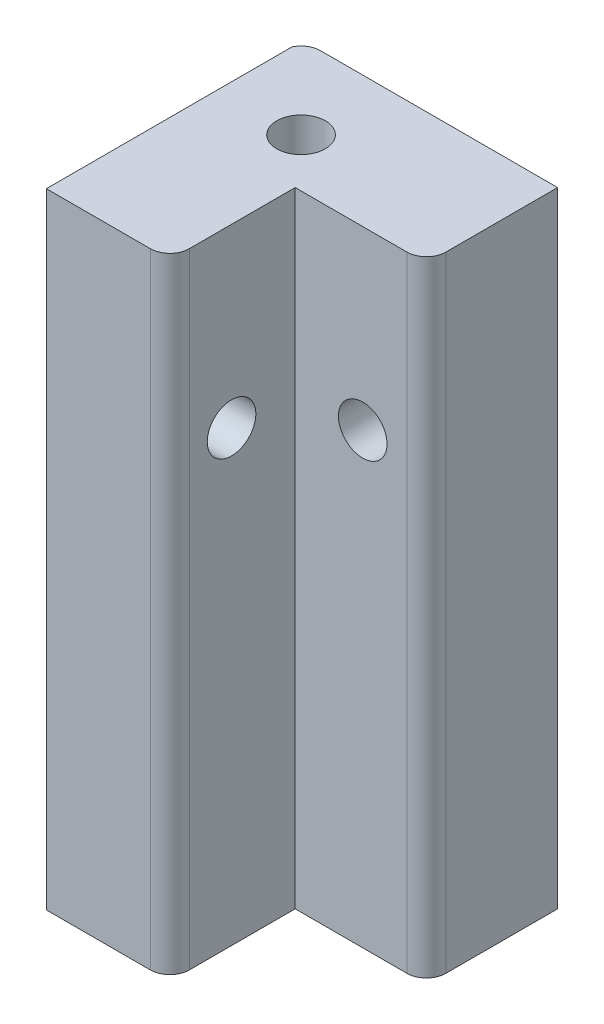
from build123d import *

# Parameters (mm, degrees)
HOLE_TOPMAIN_OUTLINE_W = 12.9
HOLE_TOPMAIN_OUTLINE_H = 12.9
HOLE_TOPMAIN_OUTLINE_R = 2.5
HOLE_TOPMAIN_DEPTH     = 64.27
SKETCH14_R             = 2.5
CUT_EXTRUDE9_DEPTH     = 67.100627077
SKETCH15_R             = 3.25
CUT_EXTRUDE10_DEPTH    = 66.309210028
SKETCH18_W             = 12.9
SKETCH18_H             = 64.27
SKETCH18_R             = 3.25
BOSS_EXTRUDE2_DEPTH    = 13.5
FILLET3_R              = 2
SKETCH19_R             = 2.5
CUT_EXTRUDE11_DEPTH    = 13.5
SKETCH22_W             = 13.5
SKETCH22_H             = 64.27
BOSS_EXTRUDE3_DEPTH    = 13.5
BOSS_EXTRUDE5_START    = -26.4
SKETCH24_R             = 3.25
BOSS_EXTRUDE5_DEPTH    = 26.4
CUT_EXTRUDE12_START    = -64.27
SKETCH25_R             = 2.5
CUT_EXTRUDE12_DEPTH    = 64.27
SKETCH26_R             = 2.5
CUT_EXTRUDE13_DEPTH    = 13.5
SKETCH28_R             = 2.5
CUT_EXTRUDE14_DEPTH    = 13.5
FILLET4_R              = 2
SKETCH29_W             = 0.2
SKETCH29_H             = 25.271779789
CUT_EXTRUDE15_DEPTH    = 64.27


# Read off the part's stored shape, not the designer's step: hole-TopMain
with BuildPart() as part:
    # hole-TopMain outline → hole-TopMain (new body)
    with BuildSketch(Plane(origin=(0, 0, 0), x_dir=(1, 0, 0), z_dir=(0, 1, 0))):
        with Locations((-2.05, 2.05)):
            Rectangle(HOLE_TOPMAIN_OUTLINE_W, HOLE_TOPMAIN_OUTLINE_H)
        Circle(HOLE_TOPMAIN_OUTLINE_R, mode=Mode.SUBTRACT)
    extrude(amount=HOLE_TOPMAIN_DEPTH)

    # Sketch14 → Cut-Extrude9 (cut, through all)
    with BuildSketch(Plane(origin=(0, 0, -8.5), x_dir=(-1, 0, 0), z_dir=(0, 0, -1))):
        with Locations((1.75, 46.135)):
            Circle(SKETCH14_R)
    extrude(amount=-CUT_EXTRUDE9_DEPTH, mode=Mode.SUBTRACT)

    # Sketch15 → Cut-Extrude10 (cut, through all)
    with BuildSketch(Plane(origin=(0, 0, -3.5), x_dir=(-1, 0, 0), z_dir=(0, 0, -1))):
        with Locations((1.75, 46.135)):
            Circle(SKETCH15_R)
    extrude(amount=-CUT_EXTRUDE10_DEPTH, mode=Mode.SUBTRACT)

    # Sketch18 → Boss-Extrude2 (add)
    with BuildSketch(Plane.XY.offset(4.4)):
        with Locations((-2.05, 32.135)):
            Rectangle(SKETCH18_W, SKETCH18_H)
        with Locations(Location((-1.75, 46.135, 0), (0, 0, 180))):
            Circle(SKETCH18_R, mode=Mode.SUBTRACT)
    extrude(amount=BOSS_EXTRUDE2_DEPTH)

    # Fillet3
    fillet3_edges = [part.edges().sort_by_distance(p)[0] for p in [
        (-8.5, 32.135, -8.5),
        (4.4, 32.135, 17.9),
    ]]
    fillet(fillet3_edges, radius=FILLET3_R)

    # Sketch19 → Cut-Extrude11 (cut)
    with BuildSketch(Plane.ZY.offset(8.5)):
        with Locations((11.55, 46.135)):
            Circle(SKETCH19_R)
    extrude(amount=-CUT_EXTRUDE11_DEPTH, mode=Mode.SUBTRACT)

    # Sketch22 → Boss-Extrude3 (add)
    with BuildSketch(Plane(origin=(4.4, 0, 0), x_dir=(0, 0, -1), z_dir=(1, 0, 0))):
        with Locations((1.75, 32.135)):
            Rectangle(SKETCH22_W, SKETCH22_H)
    extrude(amount=BOSS_EXTRUDE3_DEPTH)

    # Sketch24 → Boss-Extrude5 (add)
    with BuildSketch(Plane.XY.offset(17.9).offset(BOSS_EXTRUDE5_START)):
        with Locations((-1.75, 46.135)):
            Circle(SKETCH24_R)
    extrude(amount=BOSS_EXTRUDE5_DEPTH)

    # Sketch25 → Cut-Extrude12 (cut)
    with BuildSketch(Plane(origin=(0, 64.27, 0), x_dir=(1, 0, 0), z_dir=(0, 1, 0)).offset(CUT_EXTRUDE12_START)):
        with Locations(Location((0, 0, 0), (0, 0, 90))):
            Circle(SKETCH25_R)
    extrude(amount=CUT_EXTRUDE12_DEPTH, mode=Mode.SUBTRACT)

    # Sketch26 → Cut-Extrude13 (cut)
    with BuildSketch(Plane.ZY.offset(8.5)):
        with Locations((11.55, 46.135)):
            Circle(SKETCH26_R)
    extrude(amount=-CUT_EXTRUDE13_DEPTH, mode=Mode.SUBTRACT)

    # Sketch28 → Cut-Extrude14 (cut)
    with BuildSketch(Plane(origin=(0, 0, -8.5), x_dir=(-1, 0, 0), z_dir=(0, 0, -1))):
        with Locations((-11.35, 46.135)):
            Circle(SKETCH28_R)
    extrude(amount=-CUT_EXTRUDE14_DEPTH, mode=Mode.SUBTRACT)

    # Fillet4
    fillet4_edges = [part.edges().sort_by_distance(p)[0] for p in [
        (17.9, 32.135, 5),
    ]]
    fillet(fillet4_edges, radius=FILLET4_R)

    # Sketch29 → Cut-Extrude15 (cut)
    with BuildSketch(Plane(origin=(0, 64.27, 0), x_dir=(1, 0, 0), z_dir=(0, 1, 0))):
        with Locations((-8.4, -5.264110106)):
            Rectangle(SKETCH29_W, SKETCH29_H)
    extrude(amount=-CUT_EXTRUDE15_DEPTH, mode=Mode.SUBTRACT)


solid = part.part
